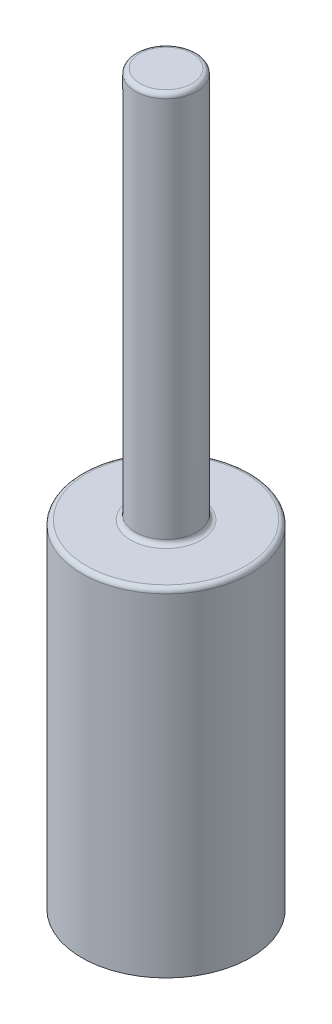
from build123d import *

# Parameters (mm, degrees)
SKETCH1_R           = 2
BOSS_EXTRUDE1_DEPTH = 11.5
BOSS_EXTRUDE2_START = 14
SKETCH3_R           = 2
BOSS_EXTRUDE2_DEPTH = 14
SKETCH4_R           = 2
BOSS_EXTRUDE3_DEPTH = 24
SKETCH5_R           = 5.5
BOSS_EXTRUDE4_DEPTH = 22
FILLET1_R           = 0.3
FILLET2_R           = 0.3
SKETCH6_R           = 2.85
SKETCH6_R_2         = 2.7
CUT_EXTRUDE1_DEPTH  = 0.1
FILLET3_R           = 0.3
SKETCH7_R           = 5
SKETCH7_R_2         = 4.5
CUT_EXTRUDE2_DEPTH  = 0.3
FILLET4_R           = 0.2


with BuildPart() as part:
    # Sketch1 → Boss-Extrude1 (new body)
    with BuildSketch(Plane(origin=(0, 0, 0), x_dir=(1, 0, 0), z_dir=(0, 1, 0))):
        with Locations(Location((0, 0, 0), (0, 0, 270))):
            Circle(SKETCH1_R)
    extrude(amount=-BOSS_EXTRUDE1_DEPTH)

    # Sketch3 → Boss-Extrude2 (add)
    with BuildSketch(Plane(origin=(0, 0, 0), x_dir=(1, 0, 0), z_dir=(0, 1, 0)).offset(BOSS_EXTRUDE2_START)):
        with Locations(Location((0, 0, 0), (0, 0, 270))):
            Circle(SKETCH3_R)
    extrude(amount=-BOSS_EXTRUDE2_DEPTH)

    # Sketch4 → Boss-Extrude3 (add)
    with BuildSketch(Plane.XZ.offset(11.5)):
        with Locations(Location((0, 0, 0), (0, 0, 90))):
            Circle(SKETCH4_R)
    extrude(amount=BOSS_EXTRUDE3_DEPTH)

    # Sketch5 → Boss-Extrude4 (add)
    with BuildSketch(Plane(origin=(0, -33.5, 0), x_dir=(-1, 0, 0), z_dir=(0, -1, 0))):
        with Locations(Location((0, 0, 0), (0, 0, 90))):
            Circle(SKETCH5_R)
    extrude(amount=-BOSS_EXTRUDE4_DEPTH)

    # Fillet1
    fillet1_edges = [part.edges().sort_by_distance(p)[0] for p in [
        (0, -35.5, -2),
        (0, 14, -2),
    ]]
    fillet(fillet1_edges, radius=FILLET1_R)

    # Fillet2
    fillet2_edges = [part.edges().sort_by_distance(p)[0] for p in [
        (0, -33.5, -2),
        (0, -11.5, -2),
        (0, -11.5, 5.5),
    ]]
    fillet(fillet2_edges, radius=FILLET2_R)

    # Sketch6 → Cut-Extrude1 (cut)
    with BuildSketch(Plane.XZ.offset(33.5)):
        with Locations(Location((0, 0, 0), (0, 0, 270))):
            Circle(SKETCH6_R)
        with Locations(Location((0, 0, 0), (0, 0, 270))):
            Circle(SKETCH6_R_2, mode=Mode.SUBTRACT)
    extrude(amount=-CUT_EXTRUDE1_DEPTH, mode=Mode.SUBTRACT)

    # Fillet3
    # the kernel refuses this fillet: 0.3 mm, written as the material it takes off along each edge
    with BuildSketch(Plane(origin=(0, -33.5, 0), x_dir=(0, 0, -1), z_dir=(-1, 0, 0))) as fillet3_piece_1:
        with BuildLine():
            CenterArc((2.476393202, -0.3), FILLET3_R, 41.810314896, 48.189685104)
            Line((2.476393202, 0), (2.476393202, 0.006))
            Line((2.476393202, 0.006), (2.7, 0.006))
            Line((2.7, 0.006), (2.706, 0))
            ThreePointArc((2.706, 0), (2.706, -0.05), (2.704472136, -0.096))
            Line((2.704472136, -0.096), (2.7, -0.1))
        make_face()
    revolve(axis=Axis((0, -33.5, 0), (0, -1, 0)), mode=Mode.SUBTRACT)

    # Sketch7 → Cut-Extrude2 (cut)
    with BuildSketch(Plane.XZ.offset(33.5)):
        with Locations(Location((0, 0, 0), (0, 0, 270))):
            Circle(SKETCH7_R)
        with Locations(Location((0, 0, 0), (0, 0, 270))):
            Circle(SKETCH7_R_2, mode=Mode.SUBTRACT)
    extrude(amount=-CUT_EXTRUDE2_DEPTH, mode=Mode.SUBTRACT)

    # Fillet4
    fillet4_edges = [part.edges().sort_by_distance(p)[0] for p in [
        (0, -33.5, 5),
        (0, -33.5, 4.5),
    ]]
    fillet(fillet4_edges, radius=FILLET4_R)


solid = part.part
